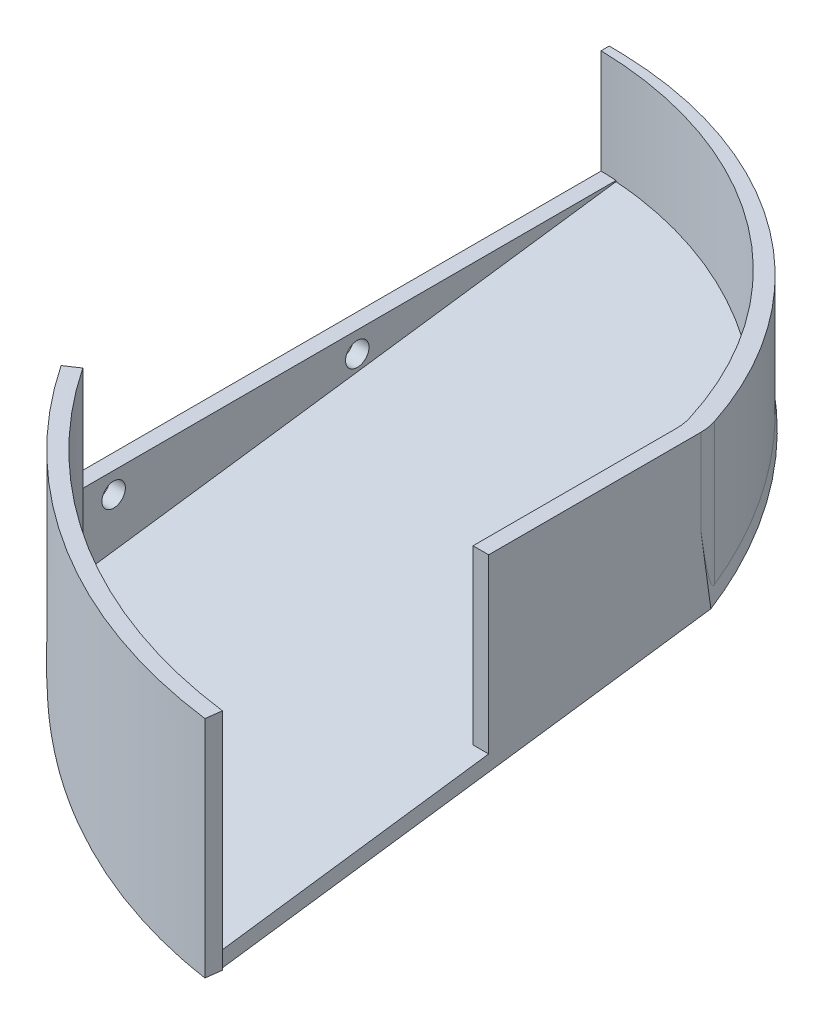
from build123d import *

# Parameters (mm, degrees)
BOSS_EXTRUDE1_DEPTH            = 3
SKETCH2_W                      = 70
SKETCH2_H                      = 151.595005295
BOSS_EXTRUDE2_DEPTH            = 3
BOSS_EXTRUDE3_DEPTH            = 20
BOSS_EXTRUDE3_DEPTH_BACK       = 30
CUT_EXTRUDE2_START             = -33
CUT_EXTRUDE2_DEPTH             = 33
CUT_EXTRUDE4_DEPTH             = 115
FILLET1_R                      = 10
FILLET2_R                      = 10
CUT_EXTRUDE6_REACH             = 171.695
SKETCH9_RX                     = 2.25
SKETCH9_RY                     = 2.229295084
CUT_EXTRUDE7_REACH             = 170.42
SKETCH10_R                     = 2.25
CUT_EXTRUDE8_REACH             = 170.259
CUT_EXTRUDE8_DIRECTION_2_DEPTH = 94
CUT_EXTRUDE10_DEPTH            = 103
CUT_EXTRUDE11_DEPTH            = 103


with BuildPart() as part:
    # Sketch1 → Boss-Extrude1 (new body)
    with BuildSketch(Plane(origin=(0, 0, 0), x_dir=(0, 0, -1), z_dir=(1, 0, 0))):
        Polygon((0, 0), (-150.2, -20.518421735), (-150.2, 3), (0, 3), align=None)
    extrude(amount=BOSS_EXTRUDE1_DEPTH)

    # Sketch2 → Boss-Extrude2 (add)
    with BuildSketch(Plane(origin=(0, 0, 0), x_dir=(1, 0, 0), z_dir=(0, -0.990797814924306, -0.1353502491361604))):
        with Locations((38, 75.797502648)):
            Rectangle(SKETCH2_W, SKETCH2_H)
    extrude(amount=-BOSS_EXTRUDE2_DEPTH)

    # Sketch5 → Boss-Extrude3 (add, two sides: drawn at the far end of the back side and taken through both)
    with BuildSketch(Plane(origin=(0, 3, 0), x_dir=(1, 0, 0), z_dir=(0, 1, 0)).offset(-BOSS_EXTRUDE3_DEPTH_BACK)):
        with BuildLine():
            Line((3, -104.05218158), (0.508313252, -105.722958989))
            ThreePointArc((0.508313252, -105.722958989), (31.90357912, -135.998781236), (73, -150.606050747))
            Line((73, -150.606050747), (73.384867861, -147.63084038))
            ThreePointArc((73.384867861, -147.63084038), (33.48282829, -133.448100531), (3, -104.05218158))
        make_face()
        with BuildLine():
            Line((70, -96.146550786), (73, -96.146550786))
            Line((73, -96.146550786), (73, -53.908597266))
            ThreePointArc((73, -53.908597266), (46.665766377, -15.719157646), (3, -0.059463978))
            Line((3, -0.059463978), (0, 0))
            Line((0, 0), (0, -1.572100517))
            ThreePointArc((0, -1.572100517), (43.8980516, -17.106077573), (70, -55.668127145))
            Line((70, -55.668127145), (70, -96.146550786))
        make_face()
    extrude(amount=BOSS_EXTRUDE3_DEPTH + BOSS_EXTRUDE3_DEPTH_BACK)

    # Sketch6 → Cut-Extrude2 (cut)
    with BuildSketch(Plane(origin=(0, 3, 0), x_dir=(1, 0, 0), z_dir=(0, 1, 0)).offset(CUT_EXTRUDE2_START)):
        with BuildLine():
            Line((0.508313252, -105.722958989), (0, -105.722958989))
            Line((0, -105.722958989), (0, -169.051425707))
            Line((0, -169.051425707), (84.981522018, -167.575878665))
            Line((84.981522018, -167.575878665), (85.31506111, -151.454848331))
            ThreePointArc((85.31506111, -151.454848331), (37.248522369, -139.090866233), (0.508313252, -105.722958989))
        make_face()
    extrude(amount=CUT_EXTRUDE2_DEPTH, mode=Mode.SUBTRACT)

    # Sketch8 → Cut-Extrude4 (cut)
    with BuildSketch(Plane(origin=(0, 2.972393445, 0.406050747), x_dir=(1, 0, 0), z_dir=(0, 0.9907978149243061, 0.1353502491361604))):
        with BuildLine():
            Line((8.157388122, 0), (3.866033028, 8.216650166))
            Line((3.866033028, 8.216650166), (75.705799011, 9.438735577))
            Line((75.705799011, 9.438735577), (81.706260282, -54.811535315))
            Line((81.706260282, -54.811535315), (73, -53.999459539))
            add(Edge.make_bspline(
                [(73, -53.999459539), (58.436791521, -5.155527194), (8.157388122, 0)],
                knots=[1.863103522, 1.863103522, 1.863103522, 3.040346046, 3.040346046, 3.040346046], degree=2, weights=[1, 0.831706965, 1]))
        make_face()
    extrude(amount=-CUT_EXTRUDE4_DEPTH, mode=Mode.SUBTRACT)

    # Fillet1
    fillet1_edges = [part.edges().sort_by_distance(p)[0] for p in [
        (70, 9.211594228, 55.668127145),
    ]]
    fillet(fillet1_edges, radius=FILLET1_R)

    # Fillet2
    fillet2_edges = [part.edges().sort_by_distance(p)[0] for p in [
        (73, 9.331776571, 53.908597266),
    ]]
    fillet(fillet2_edges, radius=FILLET2_R)

    # Sketch9 → Cut-Extrude6 (cut, up to next)
    with BuildSketch(Plane(origin=(0, 0, 0), x_dir=(1, 0, 0), z_dir=(0, -0.9907978149243061, -0.1353502491361604)), mode=Mode.PRIVATE) as cut_extrude6_sk1:
        with Locations((61.74470656, 142.332218695)):
            Ellipse(SKETCH9_RX, SKETCH9_RY)
    cut_extrude6_tool1 = extrude(cut_extrude6_sk1.sketch, amount=-CUT_EXTRUDE6_REACH, mode=Mode.PRIVATE) & part.part
    add(cut_extrude6_tool1.solids().sort_by_distance((61.744707, -19.264701, 141.022451))[0], mode=Mode.SUBTRACT)

    # Sketch10 → Cut-Extrude7 (cut, up to next)
    with BuildSketch(Plane(origin=(3, 0, 0), x_dir=(0, 0, -1), z_dir=(1, 0, 0)), mode=Mode.PRIVATE) as cut_extrude7_sk1:
        with Locations((-98.132011667, -1)):
            Circle(SKETCH10_R)
    cut_extrude7_tool1 = extrude(cut_extrude7_sk1.sketch, amount=-CUT_EXTRUDE7_REACH, mode=Mode.PRIVATE) & part.part
    # Sketch10 → Cut-Extrude7 (cut, up to next)
    with BuildSketch(Plane(origin=(3, 0, 0), x_dir=(0, 0, -1), z_dir=(1, 0, 0)), mode=Mode.PRIVATE) as cut_extrude7_sk2:
        with Locations((-51.366561707, -1)):
            Circle(SKETCH10_R)
    cut_extrude7_tool2 = extrude(cut_extrude7_sk2.sketch, amount=-CUT_EXTRUDE7_REACH, mode=Mode.PRIVATE) & part.part
    add(cut_extrude7_tool1.solids().sort_by_distance((3, -1, 98.132012))[0], mode=Mode.SUBTRACT)
    add(cut_extrude7_tool2.solids().sort_by_distance((3, -1, 51.366562))[0], mode=Mode.SUBTRACT)

    # Sketch11 → Cut-Extrude8 (cut, up to next)
    with BuildSketch(Plane.ZY.offset(-70), mode=Mode.PRIVATE) as cut_extrude8_sk1:
        Polygon((1.572100517, -0.214760462), (55.668127145, -7.6046745), (96.146550786, -13.134324084), (96.146550786, -41.889826019), (-9.48276517, -44.187208781), (-10.51145645, 3.110071472), align=None)
    cut_extrude8_tool1 = extrude(cut_extrude8_sk1.sketch, amount=-CUT_EXTRUDE8_REACH, mode=Mode.PRIVATE) & part.part
    add(cut_extrude8_tool1.solids().sort_by_distance((70, -24.126117, 38.967625))[0], mode=Mode.SUBTRACT)

    # Sketch11 → Cut-Extrude8 direction 2 (cut)
    with BuildSketch(Plane.ZY.offset(-70)):
        Polygon((1.572100517, -0.214760462), (55.668127145, -7.6046745), (96.146550786, -13.134324084), (96.146550786, -41.889826019), (-9.48276517, -44.187208781), (-10.51145645, 3.110071472), align=None)
    extrude(amount=CUT_EXTRUDE8_DIRECTION_2_DEPTH, mode=Mode.SUBTRACT)

    # Sketch13 → Cut-Extrude10 (cut)
    with BuildSketch(Plane(origin=(49.061037193, 0, 73.166380855), x_dir=(-0.8305622493340057, 0, 0.556925802940784), z_dir=(-0.556925802940784, 0, -0.8305622493340057))):
        with BuildLine():
            add(Edge.make_bspline(
                [(21.560230981, -20.160551034), (55.065377745, -19.353871971), (55.453871297, -14.312852969)],
                knots=[2.302685869, 2.302685869, 2.302685869, 3.141335194, 3.141335194, 3.141335194], degree=2, weights=[1, 0.912467114, 0.998151378]))
            Line((21.560230981, -20.160551034), (25.058225156, -40.816273576))
            Line((25.058225156, -40.816273576), (81.118244806, -31.322651564))
            Line((81.118244806, -31.322651564), (73.698165968, -14.214291239))
            Line((73.698165968, -14.214291239), (55.453871297, -14.312852969))
        make_face()
    extrude(amount=-CUT_EXTRUDE10_DEPTH, mode=Mode.SUBTRACT)

    # Sketch14 → Cut-Extrude11 (cut)
    with BuildSketch(Plane(origin=(90.960043904, 0, 11.766427665), x_dir=(0.12828928714903373, 0, -0.9917367890739925), z_dir=(0.9917367890739925, 0, 0.12828928714903373))):
        Polygon((-139.629189391, -20.122955404), (-133.475097378, -20.122955404), (-133.475097378, -31.457099509), (-143.175056738, -29.840591421), align=None)
    extrude(amount=-CUT_EXTRUDE11_DEPTH, mode=Mode.SUBTRACT)


solid = part.part
